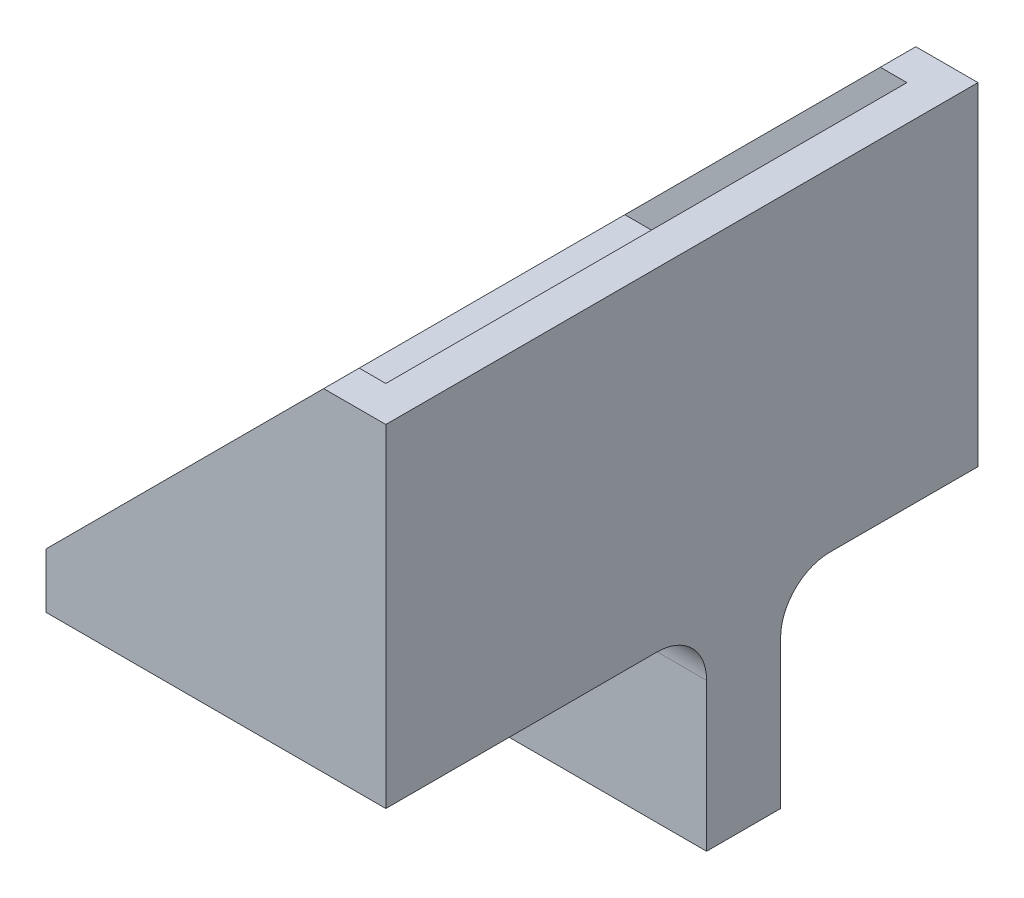
from build123d import *

# Parameters (mm, degrees)
BOSS_EXTRUDE1_DEPTH     = 76.2
CUT_EXTRUDE1_DEPTH      = 32
CUT_EXTRUDE1_DEPTH_BACK = 11.07899994
SKETCH2_W               = 46.228
SKETCH2_H               = 67.056
CHAMFER2_SIZE           = 11.313708499
CHAMFER2_SIZE_2         = 8
CHAMFER3_SIZE           = 10
CHAMFER3_SIZE2          = 7.071067812
SKETCH3_R               = 3.175
CUT_EXTRUDE2_DEPTH      = 89.533824561
SKETCH8_W               = 43.728932188
SKETCH8_H               = 9.525
BOSS_EXTRUDE3_DEPTH     = 25.4
SKETCH9_R               = 3.175
CUT_EXTRUDE3_DEPTH      = 70.342045029
FILLET2_R               = 6.35


with BuildPart() as part:
    # Sketch1 → Boss-Extrude1 (new body)
    with BuildSketch(Plane.XY):
        Polygon((30.841032184, 29.793919389), (-19.958967816, -21.006080611), (30.841032184, -21.006080611), align=None)
    extrude(amount=BOSS_EXTRUDE1_DEPTH)

    # Sketch2 → Cut-Extrude1 (cut, two sides: drawn at the far end of the back side and taken through both)
    with BuildSketch(Plane(origin=(0, 0, 0), x_dir=(1, 0, 0), z_dir=(0, 1, 0)).offset(-CUT_EXTRUDE1_DEPTH_BACK)):
        with Locations((3.155032184, -38.1)):
            Rectangle(SKETCH2_W, SKETCH2_H)
    extrude(amount=CUT_EXTRUDE1_DEPTH + CUT_EXTRUDE1_DEPTH_BACK, mode=Mode.SUBTRACT)

    # Chamfer2
    # the kernel refuses this chamfer: 11.313708499, 8 mm, written as the material it takes off along each edge
    with BuildSketch(Plane(origin=(30.841032184, 29.793919389, -29.095271678), x_dir=(-0.7262819568766876, -0.6873969152646594, 0), z_dir=(0, 0, 1))) as chamfer2_piece_1:
        Polygon((CHAMFER2_SIZE * 0.99962191691, CHAMFER2_SIZE * 0.0274958766105), (CHAMFER2_SIZE_2 * 0.687396915265, CHAMFER2_SIZE_2 * 0.726281956877), (0, 0), align=None)
    extrude(amount=134.390543355, mode=Mode.SUBTRACT)

    # Chamfer3
    chamfer3_edges = [part.edges().sort_by_distance(p)[0] for p in [
        (-19.958967816, -21.006080611, 38.1),
    ]]
    chamfer3_side = [part.faces().sort_by_distance(p)[0] for p in [
        (1.441032184, 0.393919389, 0.973145416),
    ]]
    chamfer(chamfer3_edges, length=CHAMFER3_SIZE, length2=CHAMFER3_SIZE2, reference=chamfer3_side[0])

    # Sketch3 → Cut-Extrude2 (cut, through all)
    with BuildSketch(Plane(origin=(0, -11.07899994, 0), x_dir=(1, 0, 0), z_dir=(0, 1, 0))):
        with Locations(Location((8.97656609, -12.7, 0), (0, 0, 270))):
            Circle(SKETCH3_R)
    extrude(amount=-CUT_EXTRUDE2_DEPTH, mode=Mode.SUBTRACT)

    # Sketch8 → Boss-Extrude3 (add)
    with BuildSketch(Plane.XZ.offset(21.006080611)):
        with Locations((8.97656609, 30.1625)):
            Rectangle(SKETCH8_W, SKETCH8_H)
    extrude(amount=BOSS_EXTRUDE3_DEPTH)

    # Sketch9 → Cut-Extrude3 (cut, through all)
    with BuildSketch(Plane.XY.offset(34.925)):
        with Locations((8.97656609, -33.706080611)):
            Circle(SKETCH9_R)
    extrude(amount=-CUT_EXTRUDE3_DEPTH, mode=Mode.SUBTRACT)

    # Fillet2
    fillet2_edges = [part.edges().sort_by_distance(p)[0] for p in [
        (8.97656609, -21.006080611, 34.925),
        (8.97656609, -21.006080611, 25.4),
    ]]
    fillet(fillet2_edges, radius=FILLET2_R)


solid = part.part
